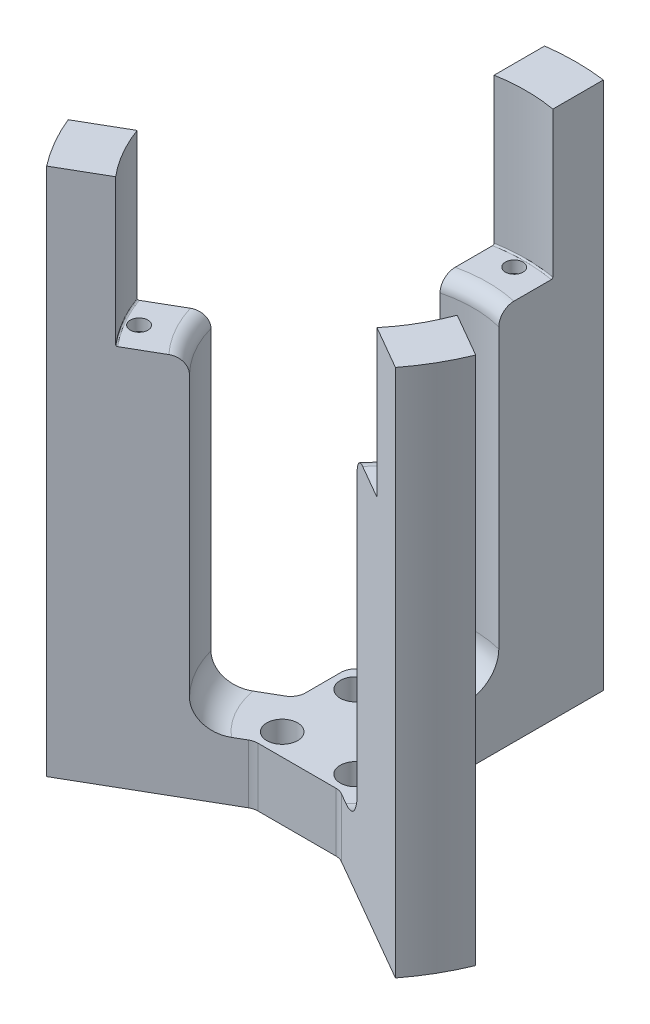
from build123d import *

# Parameters (mm, degrees)
BOSS_EXTRUDE1_DEPTH = 20
BOSS_EXTRUDE2_DEPTH = 160
SKETCH3_R           = 58
CUT_EXTRUDE1_DEPTH  = 50
SKETCH4_R           = 3
CUT_EXTRUDE2_DEPTH  = 4
CIRPATTERN1_COUNT   = 3
BOSS_EXTRUDE3_DEPTH = 20
SKETCH5_R           = 3.2
CUT_EXTRUDE3_DEPTH  = 190.835375153
FILLET1_R           = 10
FILLET2_R           = 5
FILLET4_R           = 0.5
SKETCH7_R           = 5.25
CUT_EXTRUDE4_DEPTH  = 10


with BuildPart() as part:
    # Sketch1 → Boss-Extrude1 (new body)
    with BuildSketch(Plane(origin=(0, 0, 0), x_dir=(1, 0, 0), z_dir=(0, 1, 0))):
        with BuildLine():
            Line((-10, 0), (-10, 74.330343737))
            ThreePointArc((-10, 74.330343737), (0, 75), (10, 74.330343737))
            Line((10, 74.330343737), (10, 0))
            ThreePointArc((10, 0), (0, -10), (-10, 0))
        make_face()
    boss_extrude1 = extrude(amount=BOSS_EXTRUDE1_DEPTH)

    # Sketch2 → Boss-Extrude2 (add)
    with BuildSketch(Plane(origin=(0, 20, 0), x_dir=(1, 0, 0), z_dir=(0, 1, 0))):
        with BuildLine():
            Line((-10, 74.330343737), (-10, 38.729833462))
            ThreePointArc((-10, 38.729833462), (0, 40), (10, 38.729833462))
            Line((10, 38.729833462), (10, 74.330343737))
            ThreePointArc((10, 74.330343737), (0, 75), (-10, 74.330343737))
        make_face()
    boss_extrude2 = extrude(amount=BOSS_EXTRUDE2_DEPTH)

    # Sketch3 → Cut-Extrude1 (cut)
    with BuildSketch(Plane(origin=(0, 180, 0), x_dir=(1, 0, 0), z_dir=(0, 1, 0))):
        Circle(SKETCH3_R)
    cut_extrude1 = extrude(amount=-CUT_EXTRUDE1_DEPTH, mode=Mode.SUBTRACT)

    # Sketch4 → Cut-Extrude2 (cut)
    with BuildSketch(Plane(origin=(0, 130, 0), x_dir=(1, 0, 0), z_dir=(0, 1, 0))):
        with Locations(Location((0, 53.975, 0), (0, 0, 270))):
            Circle(SKETCH4_R)
    cut_extrude2 = extrude(amount=-CUT_EXTRUDE2_DEPTH, mode=Mode.SUBTRACT)

    # CirPattern1: Boss-Extrude1, Boss-Extrude2, Cut-Extrude1, Cut-Extrude2 ×3 about axis
    cirpattern1_axis = Axis((0, 0, 0), (0, 1, 0))
    add([boss_extrude1.rotate(cirpattern1_axis, i * 360 / CIRPATTERN1_COUNT) for i in range(1, CIRPATTERN1_COUNT)])
    add([boss_extrude2.rotate(cirpattern1_axis, i * 360 / CIRPATTERN1_COUNT) for i in range(1, CIRPATTERN1_COUNT)])
    add([cut_extrude1.rotate(cirpattern1_axis, i * 360 / CIRPATTERN1_COUNT) for i in range(1, CIRPATTERN1_COUNT)], mode=Mode.SUBTRACT)
    add([cut_extrude2.rotate(cirpattern1_axis, i * 360 / CIRPATTERN1_COUNT) for i in range(1, CIRPATTERN1_COUNT)], mode=Mode.SUBTRACT)

    # Sketch6 → Boss-Extrude3 (add)
    with BuildSketch(Plane(origin=(0, 0, 0), x_dir=(1, 0, 0), z_dir=(0, 1, 0))):
        with BuildLine():
            Line((15, -20), (-15, -20))
            ThreePointArc((-15, -20), (-18.535533906, -18.535533906), (-20, -15))
            Line((-20, -15), (-20, 15))
            ThreePointArc((-20, 15), (-18.535533906, 18.535533906), (-15, 20))
            Line((-15, 20), (15, 20))
            ThreePointArc((15, 20), (18.535533906, 18.535533906), (20, 15))
            Line((20, 15), (20, -15))
            ThreePointArc((20, -15), (18.535533906, -18.535533906), (15, -20))
        make_face()
    extrude(amount=BOSS_EXTRUDE3_DEPTH)

    # Sketch5 → Cut-Extrude3 (cut, through all)
    with BuildSketch(Plane(origin=(0, 20, 0), x_dir=(1, 0, 0), z_dir=(0, 1, 0))):
        with Locations(Location((-12.5, 12.5, 0), (0, 0, 270))):
            Circle(SKETCH5_R)
        with Locations(Location((12.5, 12.5, 0), (0, 0, 270))):
            Circle(SKETCH5_R)
        with Locations(Location((-12.5, -12.5, 0), (0, 0, 270))):
            Circle(SKETCH5_R)
        with Locations(Location((12.5, -12.5, 0), (0, 0, 270))):
            Circle(SKETCH5_R)
    extrude(amount=-CUT_EXTRUDE3_DEPTH, mode=Mode.SUBTRACT)

    # Fillet1
    fillet1_edges = [part.edges().sort_by_distance(p)[0] for p in [
        (0, 20, -40),
        (34.641016151, 20, 20),
        (-34.641016151, 20, 20),
    ]]
    fillet(fillet1_edges, radius=FILLET1_R)

    # Fillet2
    fillet2_edges = [part.edges().sort_by_distance(p)[0] for p in [
        (34.641016151, 130, 20),
        (-14.641016151, 10, 20),
        (-20, 10, 0),
        (20, 10, 0),
        (10, 10, -20),
        (-10, 10, -20),
        (14.641016151, 10, 20),
        (0, 130, -40),
        (-34.641016151, 130, 20),
    ]]
    fillet(fillet2_edges, radius=FILLET2_R - 0.0001)  # a hair under: the kernel refuses the full size

    # Fillet4
    fillet4_edges = [part.edges().sort_by_distance(p)[0] for p in [
        (50.229473419, 130, 29),
        (-50.229473419, 130, 29),
        (0, 130, -58),
    ]]
    fillet(fillet4_edges, radius=FILLET4_R)

    # Sketch7 → Cut-Extrude4 (cut)
    with BuildSketch(Plane(origin=(0, 20, 0), x_dir=(1, 0, 0), z_dir=(0, 1, 0))):
        with Locations(Location((-12.5, 12.5, 0), (0, 0, 270))):
            Circle(SKETCH7_R)
        with Locations(Location((12.5, 12.5, 0), (0, 0, 270))):
            Circle(SKETCH7_R)
        with Locations(Location((12.5, -12.5, 0), (0, 0, 270))):
            Circle(SKETCH7_R)
        with Locations(Location((-12.5, -12.5, 0), (0, 0, 270))):
            Circle(SKETCH7_R)
    extrude(amount=-CUT_EXTRUDE4_DEPTH, mode=Mode.SUBTRACT)


solid = part.part
